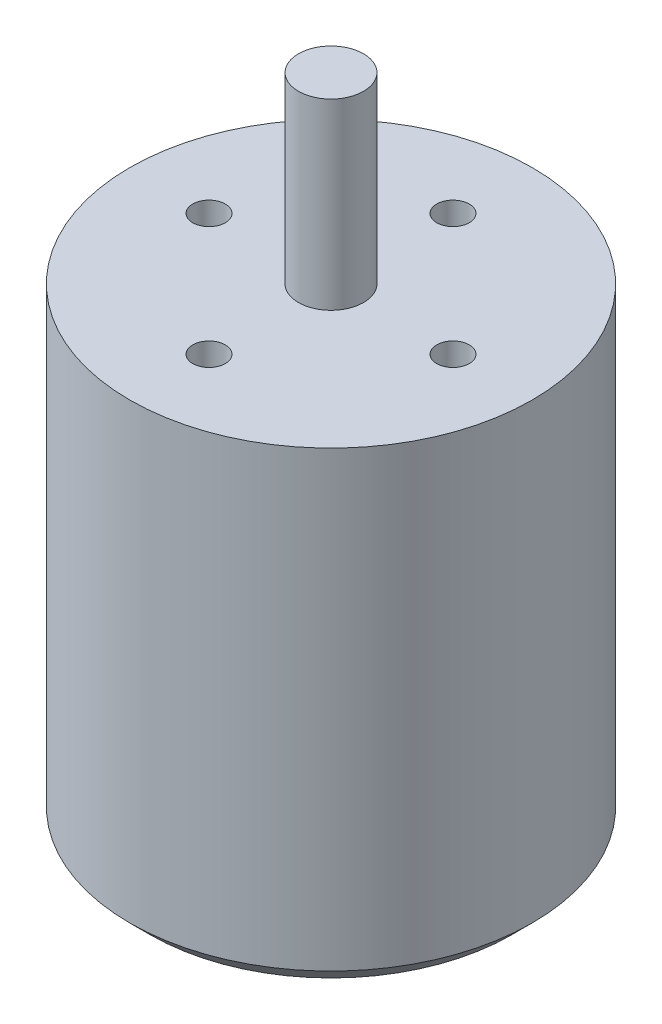
from build123d import *

# Parameters (mm, degrees)
SKETCH1_R           = 24.75
BOSS_EXTRUDE1_DEPTH = 58.2
SKETCH2_R           = 4
BOSS_EXTRUDE2_DEPTH = 22.5
CHAMFER1_SIZE       = 2.5
SKETCH3_R           = 6.8
BOSS_EXTRUDE3_DEPTH = 2
FILLET1_R           = 0.5
SKETCH4_R           = 2
CUT_EXTRUDE1_DEPTH  = 10
SKETCH5_R           = 1.5
CUT_EXTRUDE2_DEPTH  = 5


with BuildPart() as part:
    # Sketch1 → Boss-Extrude1 (new body)
    with BuildSketch(Plane(origin=(0, 0, 0), x_dir=(1, 0, 0), z_dir=(0, 1, 0))):
        Circle(SKETCH1_R)
    extrude(amount=BOSS_EXTRUDE1_DEPTH)

    # Sketch2 → Boss-Extrude2 (add)
    with BuildSketch(Plane(origin=(0, 58.2, 0), x_dir=(1, 0, 0), z_dir=(0, 1, 0))):
        Circle(SKETCH2_R)
    extrude(amount=BOSS_EXTRUDE2_DEPTH)

    # Chamfer1
    chamfer1_edges = [part.edges().sort_by_distance(p)[0] for p in [
        (-24.75, 0, 0),
    ]]
    chamfer(chamfer1_edges, length=CHAMFER1_SIZE)

    # Sketch3 → Boss-Extrude3 (add)
    with BuildSketch(Plane.XZ):
        Circle(SKETCH3_R)
    extrude(amount=BOSS_EXTRUDE3_DEPTH)

    # Fillet1
    fillet1_edges = [part.edges().sort_by_distance(p)[0] for p in [
        (-6.8, 0, 0),
    ]]
    fillet(fillet1_edges, radius=FILLET1_R)

    # Sketch4 → Cut-Extrude1 (cut)
    with BuildSketch(Plane(origin=(0, 58.2, 0), x_dir=(1, 0, 0), z_dir=(0, 1, 0))):
        with Locations((0, 15)):
            Circle(SKETCH4_R)
        with Locations((15, 0)):
            Circle(SKETCH4_R)
        with Locations((0, -15)):
            Circle(SKETCH4_R)
        with Locations((-15, 0)):
            Circle(SKETCH4_R)
    extrude(amount=-CUT_EXTRUDE1_DEPTH, mode=Mode.SUBTRACT)

    # Sketch5 → Cut-Extrude2 (cut)
    with BuildSketch(Plane.XZ):
        with Locations((0, 9.875)):
            Circle(SKETCH5_R)
        with Locations((9.875, 0)):
            Circle(SKETCH5_R)
        with Locations((0, -9.875)):
            Circle(SKETCH5_R)
        with Locations((-9.875, 0)):
            Circle(SKETCH5_R)
    extrude(amount=-CUT_EXTRUDE2_DEPTH, mode=Mode.SUBTRACT)


solid = part.part
